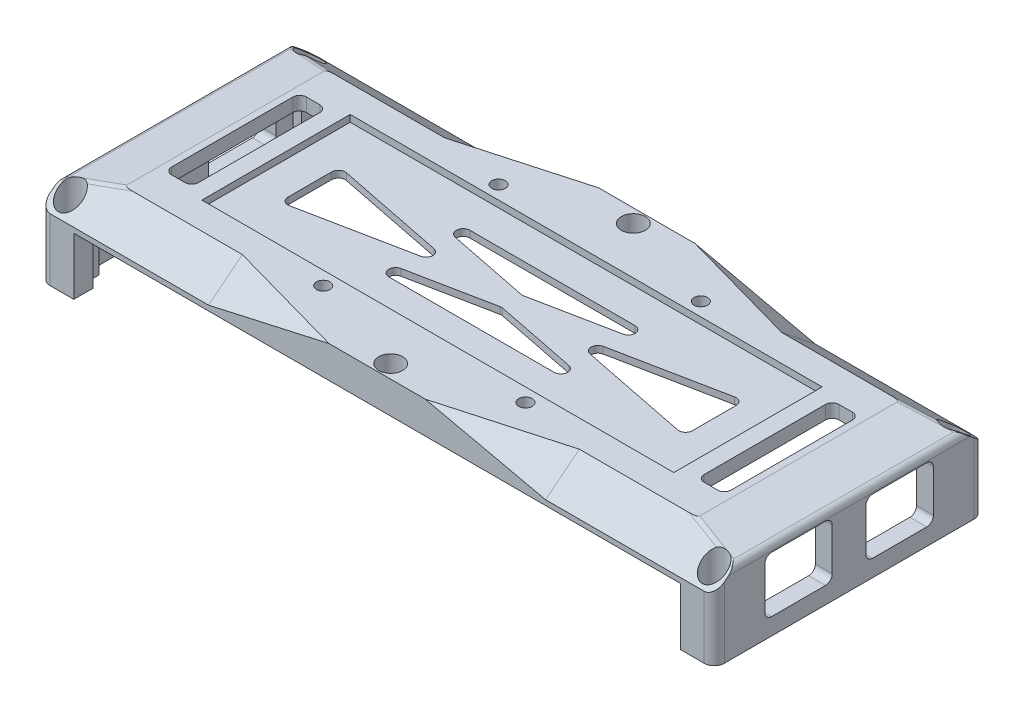
from build123d import *
from OCP.BRepFilletAPI import BRepFilletAPI_MakeChamfer

# Parameters (mm, degrees)
SKETCH_1_W               = 180
SKETCH_1_H               = 60
EXTRUDE_2_DEPTH          = 2
EXTRUDE_5_DEPTH          = 3.5
SKETCH_8_W               = 200
SKETCH_8_H               = 80
EXTRUDE_6_DEPTH          = 4
CHAMFER_4_SIZE           = 3
CHAMFER_4_SIZE2          = 15
SKETCH_10_W              = 10
SKETCH_10_H              = 80
EXTRUDE_7_DEPTH          = 17
CUT_EXTRUDE_1_DEPTH      = 110.636900722
CUT_EXTRUDE_1_DEPTH_BACK = 110.636900722
SKETCH_9_R               = 2
SKETCH_11_R              = 3.55
CUT_EXTRUDE_2_DEPTH      = 25
FILLET_1_R               = 3
SKETCH_12_R              = 3.55
CUT_EXTRUDE_3_DEPTH      = 5
CUT_EXTRUDE_4_DEPTH      = 110.636900722
CUT_EXTRUDE_4_DEPTH_BACK = 110.636900722
SKETCH_13_W              = 20
SKETCH_13_H              = 16.5
SKETCH_14_W              = 140
SKETCH_14_H              = 44
CUT_EXTRUDE_7_DEPTH      = 2
SKETCH_15_W              = 8
SKETCH_15_H              = 40
CUT_EXTRUDE_8_DEPTH      = 111.915508384
SKETCH_9_5_R             = 2
CUT_EXTRUDE_9_DEPTH      = 6
CUT_EXTRUDE_START        = -90
CUT_EXTRUDE_11_DEPTH     = 295.988414307
CHAMFER_3_SIZE           = 7
CHAMFER_3_SIZE_2         = 40
CHAMFER_5_SIZE           = 7
CHAMFER_5_SIZE_2         = 40
FILLET_2_R               = 2
SKETCH_18_W              = 29
SKETCH_18_H              = 13.5
CUT_EXTRUDE_12_DEPTH     = 92.5
SKETCH_19_W              = 5
SKETCH_19_H              = 60
CUT_EXTRUDE_13_DEPTH     = 22.5


with BuildPart() as part:
    # 草圖1 → 填料-伸長2 (new body)
    with BuildSketch(Plane(origin=(0, 0, 0), x_dir=(1, 0, 0), z_dir=(0, 1, 0))):
        Polygon((-100, -40), (100, -40), (100, -20), (100, 0), (100, 40), (-100, 40), align=None)
        Rectangle(SKETCH_1_W, SKETCH_1_H, mode=Mode.SUBTRACT)
    extrude(amount=EXTRUDE_2_DEPTH)

    # 草圖7 → 填料-伸長5 (add)
    with BuildSketch(Plane.XZ):
        Polygon((-100, 40), (-30, 40), (30, 40), (100, 40), (100, -40), (30, -40), (-30, -40), (-100, -40), align=None)
        Polygon((-30, -30), (30, -30), (90, -30), (90, 30), (30, 30), (-30, 30), (-90, 30), (-90, -30), align=None, mode=Mode.SUBTRACT)
    extrude(amount=EXTRUDE_5_DEPTH)

    # 草圖8 → 填料-伸長6 (add)
    with BuildSketch(Plane(origin=(0, 2, 0), x_dir=(1, 0, 0), z_dir=(0, 1, 0))):
        Rectangle(SKETCH_8_W, SKETCH_8_H)
    extrude(amount=EXTRUDE_6_DEPTH)

    # 導角4: one chamfer whose edges measure the first distance from different faces: ONE call of the kernel's chamfer builder (chamfer() names one face for all edges)
    chamfer_4_edges_1 = [part.edges().sort_by_distance(p)[0] for p in [
        (-100, 6, 0),
    ]]
    chamfer_4_side_1 = [part.faces().sort_by_distance(p)[0] for p in [
        (-100, 1.25, 0),
    ]]
    chamfer_4_edges_2 = [part.edges().sort_by_distance(p)[0] for p in [
        (100, 6, 0),
    ]]
    chamfer_4_side_2 = [part.faces().sort_by_distance(p)[0] for p in [
        (100, 1.25, 0),
    ]]
    chamfer_4 = BRepFilletAPI_MakeChamfer(part.part.solid().wrapped)
    for e in chamfer_4_edges_1:
        chamfer_4.Add(CHAMFER_4_SIZE, CHAMFER_4_SIZE2, e.wrapped, chamfer_4_side_1[0].wrapped)  # the first distance lies on this face
    for e in chamfer_4_edges_2:
        chamfer_4.Add(CHAMFER_4_SIZE, CHAMFER_4_SIZE2, e.wrapped, chamfer_4_side_2[0].wrapped)  # the first distance lies on this face
    add(Compound.cast(chamfer_4.Shape()), mode=Mode.REPLACE)

    # 草圖10 → 填料-伸長7 (add)
    with BuildSketch(Plane.XZ.offset(3.5)):
        with Locations((-95, 0)):
            Rectangle(SKETCH_10_W, SKETCH_10_H)
        with Locations((95, 0)):
            Rectangle(SKETCH_10_W, SKETCH_10_H)
    extrude(amount=EXTRUDE_7_DEPTH)

    # 草圖9 → 除料-伸長1 (cut, two sides: drawn at the far end of the back side and taken through both)
    with BuildSketch(Plane(origin=(0, 0, 0), x_dir=(1, 0, 0), z_dir=(0, 1, 0)).offset(-CUT_EXTRUDE_1_DEPTH_BACK)):
        with Locations(Location((95.5, 35.5, 0), (0, 0, 270))):
            Circle(SKETCH_9_R)
        with Locations((-95.5, 35.5)):
            Circle(SKETCH_9_R)
        with Locations(Location((-95.5, -35.5, 0), (0, 0, 270))):
            Circle(SKETCH_9_R)
        with Locations(Location((95.5, -35.5, 0), (0, 0, 180))):
            Circle(SKETCH_9_R)
        with Locations(Location((0, 36, 0), (0, 0, 270))):
            Circle(SKETCH_9_R)
        with Locations(Location((0, -36, 0), (0, 0, 90))):
            Circle(SKETCH_9_R)
    extrude(amount=CUT_EXTRUDE_1_DEPTH + CUT_EXTRUDE_1_DEPTH_BACK, mode=Mode.SUBTRACT)

    # 草圖11 → 除料-伸長2 (cut)
    with BuildSketch(Plane(origin=(0, 6, 0), x_dir=(1, 0, 0), z_dir=(0, 1, 0))):
        with Locations(Location((-95.497380754, 35.5, 0), (0, 0, 270))):
            Circle(SKETCH_11_R)
        with Locations((-95.497380754, -35.5)):
            Circle(SKETCH_11_R)
        with Locations(Location((95.5, -35.5, 0), (0, 0, 270))):
            Circle(SKETCH_11_R)
        with Locations(Location((95.5, 35.5, 0), (0, 0, 180))):
            Circle(SKETCH_11_R)
    extrude(amount=-CUT_EXTRUDE_2_DEPTH, mode=Mode.SUBTRACT)

    # 圓角1
    fillet_1_edges = [part.edges().sort_by_distance(p)[0] for p in [
        (-100, -8.75, 40),
        (100, -8.75, 40),
        (-100, -8.75, -40),
        (100, -8.75, -40),
    ]]
    fillet(fillet_1_edges, radius=FILLET_1_R)

    # 草圖12 → 除料-伸長3 (cut)
    with BuildSketch(Plane(origin=(0, 6, 0), x_dir=(1, 0, 0), z_dir=(0, 1, 0))):
        with Locations(Location((0, 36, 0), (0, 0, 270))):
            Circle(SKETCH_12_R)
        with Locations(Location((0, -36, 0), (0, 0, 270))):
            Circle(SKETCH_12_R)
    extrude(amount=-CUT_EXTRUDE_3_DEPTH, mode=Mode.SUBTRACT)

    # 草圖13 → 除料-伸長4 (cut, two sides: drawn at the far end of the back side and taken through both)
    with BuildSketch(Plane(origin=(0, 0, 0), x_dir=(0, 0, -1), z_dir=(1, 0, 0)).offset(-CUT_EXTRUDE_4_DEPTH_BACK)):
        with Locations((-15, -7.25)):
            Rectangle(SKETCH_13_W, SKETCH_13_H)
        with Locations((15, -7.25)):
            Rectangle(SKETCH_13_W, SKETCH_13_H)
    extrude(amount=CUT_EXTRUDE_4_DEPTH + CUT_EXTRUDE_4_DEPTH_BACK, mode=Mode.SUBTRACT)

    # 草圖14 → 除料-伸長7 (cut)
    with BuildSketch(Plane(origin=(0, 6, 0), x_dir=(1, 0, 0), z_dir=(0, 1, 0))):
        Rectangle(SKETCH_14_W, SKETCH_14_H)
    extrude(amount=-CUT_EXTRUDE_7_DEPTH, mode=Mode.SUBTRACT)

    # 草圖15 → 除料-伸長8 (cut, through all)
    with BuildSketch(Plane(origin=(0, 6, 0), x_dir=(1, 0, 0), z_dir=(0, 1, 0))):
        with Locations((-79, 0)):
            Rectangle(SKETCH_15_W, SKETCH_15_H)
        with Locations((79, 0)):
            Rectangle(SKETCH_15_W, SKETCH_15_H)
        Polygon((-44.702941459, -12), (44.702941459, -12), (0, -3.059411708), align=None)
        Polygon((-60, -8.940588292), (-60, 8.940588292), (-15.297058541, 0), align=None)
        Polygon((-44.702941459, 12), (44.702941459, 12), (0, 3.059411708), align=None)
        Polygon((60, -8.940588292), (60, 8.940588292), (15.297058541, 0), align=None)
    extrude(amount=-CUT_EXTRUDE_8_DEPTH, mode=Mode.SUBTRACT)

    # 草圖9<5> → 除料-伸長9 (cut)
    with BuildSketch(Plane(origin=(0, 0, 0), x_dir=(1, 0, 0), z_dir=(0, 1, 0))):
        with Locations(Location((30, 26, 0), (0, 0, 270))):
            Circle(SKETCH_9_5_R)
        with Locations(Location((-30, 26, 0), (0, 0, 90))):
            Circle(SKETCH_9_5_R)
        with Locations(Location((30, -26, 0), (0, 0, 90))):
            Circle(SKETCH_9_5_R)
        with Locations(Location((-30, -26, 0), (0, 0, 270))):
            Circle(SKETCH_9_5_R)
    extrude(amount=CUT_EXTRUDE_9_DEPTH, mode=Mode.SUBTRACT)

    # 草圖17 → 除料-伸長11 (cut)
    with BuildSketch(Plane(origin=(100, 0, 0), x_dir=(0, 0, -1), z_dir=(1, 0, 0)).offset(CUT_EXTRUDE_START)):
        Polygon((-40, -2), (-30, 6), (-40, 6), align=None)
        Polygon((30, 6), (40, 6), (40, -2), align=None)
    cut_extrude_11 = extrude(amount=CUT_EXTRUDE_11_DEPTH, mode=Mode.SUBTRACT)

    # 鏡射1: 除料-伸長11 across plane
    add(cut_extrude_11.mirror(Plane(origin=(0, 0, 0), x_dir=(0, 0, 1), z_dir=(1, 0, 0))), mode=Mode.SUBTRACT)

    # 導角3
    # the kernel refuses this chamfer: 40, 7 mm, written as the material it adds along each edge
    with BuildSketch(Plane(origin=(-10, -66.932308088, 121.16538511), x_dir=(0, 0.7808688094430304, 0.6246950475544243), z_dir=(0, 0.6246950475544243, -0.7808688094430304))) as chamfer_3_piece_1_section:
        Polygon((CHAMFER_3_SIZE, 0), (0, -CHAMFER_3_SIZE_2), (0, 0), align=None)
    chamfer_3_piece_1 = extrude(amount=220.691066331, mode=Mode.PRIVATE)
    chamfer_3_piece_1 = split(chamfer_3_piece_1, bisect_by=Plane(origin=(-10, -66.932308088, 40), z_dir=(0, 0, -1)), keep=Keep.TOP, mode=Mode.PRIVATE)
    chamfer_3_piece_1 = split(chamfer_3_piece_1, bisect_by=Plane(origin=(-10, 6, 121.16538511), z_dir=(0, -1, 0)), keep=Keep.TOP, mode=Mode.PRIVATE)
    add(chamfer_3_piece_1)
    with BuildSketch(Plane(origin=(-10, -66.932308088, -121.16538511), x_dir=(0, 0.7808688094430304, -0.6246950475544243), z_dir=(0, 0.6246950475544243, 0.7808688094430304))) as chamfer_3_piece_2_section:
        Polygon((CHAMFER_3_SIZE, 0), (0, CHAMFER_3_SIZE_2), (0, 0), align=None)
    chamfer_3_piece_2 = extrude(amount=220.691066331, mode=Mode.PRIVATE)
    chamfer_3_piece_2 = split(chamfer_3_piece_2, bisect_by=Plane(origin=(-10, 6, -121.16538511), z_dir=(0, -1, 0)), keep=Keep.TOP, mode=Mode.PRIVATE)
    chamfer_3_piece_2 = split(chamfer_3_piece_2, bisect_by=Plane(origin=(-10, -66.932308088, -40), z_dir=(0, 0, 1)), keep=Keep.TOP, mode=Mode.PRIVATE)
    add(chamfer_3_piece_2)

    # 導角5
    # the kernel refuses this chamfer: 40, 7 mm, written as the material it adds along each edge
    with BuildSketch(Plane(origin=(10, -66.932308088, -121.16538511), x_dir=(0, 0.7808688094430304, -0.6246950475544243), z_dir=(0, 0.6246950475544243, 0.7808688094430304))) as chamfer_5_piece_1_section:
        Polygon((CHAMFER_5_SIZE, 0), (0, -CHAMFER_5_SIZE_2), (0, 0), align=None)
    chamfer_5_piece_1 = extrude(amount=220.691066331, mode=Mode.PRIVATE)
    chamfer_5_piece_1 = split(chamfer_5_piece_1, bisect_by=Plane(origin=(10, -66.932308088, -40), z_dir=(0, 0, 1)), keep=Keep.TOP, mode=Mode.PRIVATE)
    chamfer_5_piece_1 = split(chamfer_5_piece_1, bisect_by=Plane(origin=(10, 6, -121.16538511), z_dir=(0, -1, 0)), keep=Keep.TOP, mode=Mode.PRIVATE)
    add(chamfer_5_piece_1)
    with BuildSketch(Plane(origin=(10, -66.932308088, 121.16538511), x_dir=(0, 0.7808688094430304, 0.6246950475544243), z_dir=(0, 0.6246950475544243, -0.7808688094430304))) as chamfer_5_piece_2_section:
        Polygon((CHAMFER_5_SIZE, 0), (0, CHAMFER_5_SIZE_2), (0, 0), align=None)
    chamfer_5_piece_2 = extrude(amount=220.691066331, mode=Mode.PRIVATE)
    chamfer_5_piece_2 = split(chamfer_5_piece_2, bisect_by=Plane(origin=(10, -66.932308088, 40), z_dir=(0, 0, -1)), keep=Keep.TOP, mode=Mode.PRIVATE)
    chamfer_5_piece_2 = split(chamfer_5_piece_2, bisect_by=Plane(origin=(10, 6, 121.16538511), z_dir=(0, -1, 0)), keep=Keep.TOP, mode=Mode.PRIVATE)
    add(chamfer_5_piece_2)

    # 圓角2
    # the kernel refuses this fillet: 2 mm, written as the material it adds along each edge
    with BuildSketch(Plane(origin=(75, 6, 20), x_dir=(1, 0, 0), z_dir=(0, -1, 0)), Plane(origin=(83, 6, 20), x_dir=(0, 0, -1), z_dir=(0, -1, 0)), Plane(origin=(83, 6, -20), x_dir=(-1, 0, 0), z_dir=(0, -1, 0)), Plane(origin=(-83, 6, -20), x_dir=(0, 0, 1), z_dir=(0, -1, 0)), Plane(origin=(-75, 6, 20), x_dir=(0, 0, -1), z_dir=(0, -1, 0)), Plane(origin=(-75, 6, -20), x_dir=(-1, 0, 0), z_dir=(0, -1, 0))) as fillet_2_piece_1:
        with BuildLine():
            CenterArc((FILLET_2_R, -FILLET_2_R), FILLET_2_R, 90, 90)
            Line((0, -FILLET_2_R), (0, 0))
            Line((0, 0), (FILLET_2_R, 0))
        make_face()
    extrude(amount=4)
    with BuildSketch(Plane(origin=(75, 6, -20), x_dir=(1, 0, 0), z_dir=(0, -1, 0)), Plane(origin=(-83, 6, 20), x_dir=(0, 0, -1), z_dir=(0, -1, 0))) as fillet_2_piece_2:
        with BuildLine():
            CenterArc((FILLET_2_R, FILLET_2_R), FILLET_2_R, 180, 90)
            Line((0, FILLET_2_R), (0, 0))
            Line((0, 0), (FILLET_2_R, 0))
        make_face()
    extrude(amount=4)
    with BuildSketch(Plane(origin=(90, -15.5, 25), x_dir=(0, 1, 0), z_dir=(1, 0, 0)), Plane(origin=(90, 1, -5), x_dir=(0, 0, -1), z_dir=(1, 0, 0)), Plane(origin=(-90, -15.5, 5), x_dir=(0, 1, 0), z_dir=(-1, 0, 0)), Plane(origin=(-90, -15.5, -5), x_dir=(0, 0, -1), z_dir=(-1, 0, 0))) as fillet_2_piece_3:
        with BuildLine():
            CenterArc((FILLET_2_R, -FILLET_2_R), FILLET_2_R, 90, 90)
            Line((0, -FILLET_2_R), (0, 0))
            Line((0, 0), (FILLET_2_R, 0))
        make_face()
    extrude(amount=10)
    with BuildSketch(Plane(origin=(100, -15.5, -5), x_dir=(0, 1, 0), z_dir=(-1, 0, 0)), Plane(origin=(90, 1, 25), x_dir=(0, -1, 0), z_dir=(1, 0, 0)), Plane(origin=(90, 1, -25), x_dir=(0, 0, 1), z_dir=(1, 0, 0)), Plane(origin=(100, 1, 5), x_dir=(0, -1, 0), z_dir=(-1, 0, 0)), Plane(origin=(100, -15.5, 5), x_dir=(0, 0, 1), z_dir=(-1, 0, 0)), Plane(origin=(100, -15.5, -25), x_dir=(0, 0, 1), z_dir=(-1, 0, 0)), Plane(origin=(-90, 1, 5), x_dir=(0, -1, 0), z_dir=(-1, 0, 0)), Plane(origin=(-90, -15.5, -25), x_dir=(0, 0, 1), z_dir=(-1, 0, 0)), Plane(origin=(-100, -15.5, 25), x_dir=(0, 0, -1), z_dir=(1, 0, 0)), Plane(origin=(-100, 1, 25), x_dir=(0, -1, 0), z_dir=(1, 0, 0)), Plane(origin=(-100, 1, -5), x_dir=(0, -1, 0), z_dir=(1, 0, 0)), Plane(origin=(-100, 1, -25), x_dir=(0, 0, 1), z_dir=(1, 0, 0))) as fillet_2_piece_4:
        with BuildLine():
            CenterArc((FILLET_2_R, FILLET_2_R), FILLET_2_R, 180, 90)
            Line((0, FILLET_2_R), (0, 0))
            Line((0, 0), (FILLET_2_R, 0))
        make_face()
    extrude(amount=10)
    with BuildSketch(Plane(origin=(15.297058541, 4, 0), x_dir=(0.9805806756909202, 0, 0.1961161351381835), z_dir=(0, -1, 0))) as fillet_2_piece_5:
        with BuildLine():
            CenterArc((FILLET_2_R * 5, -FILLET_2_R), FILLET_2_R, 90, 157.380135052)
            Line((FILLET_2_R * 4.61538461538, -FILLET_2_R * 1.92307692308), (0, 0))
            Line((0, 0), (FILLET_2_R * 5, 0))
        make_face()
    extrude(amount=2)
    with BuildSketch(Plane(origin=(60, 4, 8.940588292), x_dir=(-0.9805806756909204, 0, -0.19611613513818263), z_dir=(0, -1, 0)), Plane(origin=(-60, 4, 8.940588292), x_dir=(0, 0, -1), z_dir=(0, -1, 0))) as fillet_2_piece_6:
        with BuildLine():
            CenterArc((FILLET_2_R * 1.21980390272, FILLET_2_R), FILLET_2_R, 168.690067526, 101.309932474)
            Line((FILLET_2_R * 0.239223227028, FILLET_2_R * 1.19611613514), (0, 0))
            Line((0, 0), (FILLET_2_R * 1.21980390272, 0))
        make_face()
    extrude(amount=2)
    with BuildSketch(Plane(origin=(44.702941459, 4, -12), x_dir=(-1, 0, 0), z_dir=(0, -1, 0)), Plane(origin=(44.702941459, 4, 12), x_dir=(-0.9805806756909201, 0, -0.1961161351381839), z_dir=(0, -1, 0))) as fillet_2_piece_7:
        with BuildLine():
            CenterArc((FILLET_2_R * 10.0990195136, -FILLET_2_R), FILLET_2_R, 90, 168.690067526)
            Line((FILLET_2_R * 9.90290337845, -FILLET_2_R * 1.98058067569), (0, 0))
            Line((0, 0), (FILLET_2_R * 10.0990195136, 0))
        make_face()
    extrude(amount=2)
    with BuildSketch(Plane(origin=(-44.702941459, 4, 12), x_dir=(0.980580675690919, 0, -0.19611613513818962), z_dir=(0, -1, 0)), Plane(origin=(-44.702941459, 4, -12), x_dir=(1, 0, 0), z_dir=(0, -1, 0))) as fillet_2_piece_8:
        with BuildLine():
            CenterArc((FILLET_2_R * 10.0990195136, FILLET_2_R), FILLET_2_R, 101.309932474, 168.690067526)
            Line((FILLET_2_R * 9.90290337845, FILLET_2_R * 1.98058067569), (0, 0))
            Line((0, 0), (FILLET_2_R * 10.0990195136, 0))
        make_face()
    extrude(amount=2)
    with BuildSketch(Plane(origin=(0, 4, -3.059411708), x_dir=(-0.9805806756909202, 0, -0.1961161351381838), z_dir=(0, -1, 0))) as fillet_2_piece_9:
        with BuildLine():
            CenterArc((FILLET_2_R * 0.2, FILLET_2_R), FILLET_2_R, 247.380135052, 22.619864948)
            Line((-FILLET_2_R * 0.184615384615, FILLET_2_R * 0.0769230769231), (0, 0))
            Line((0, 0), (FILLET_2_R * 0.2, 0))
        make_face()
    extrude(amount=2)
    with BuildSketch(Plane(origin=(60, 4, -8.940588292), x_dir=(-0.9805806756909192, 0, 0.19611613513818835), z_dir=(0, -1, 0)), Plane(origin=(-60, 4, -8.940588292), x_dir=(0, 0, 1), z_dir=(0, -1, 0))) as fillet_2_piece_10:
        with BuildLine():
            CenterArc((FILLET_2_R * 1.21980390272, -FILLET_2_R), FILLET_2_R, 90, 101.309932474)
            Line((FILLET_2_R * 0.239223227028, -FILLET_2_R * 1.19611613514), (0, 0))
            Line((0, 0), (FILLET_2_R * 1.21980390272, 0))
        make_face()
    extrude(amount=2)
    with BuildSketch(Plane(origin=(0, 4, 3.059411708), x_dir=(-0.9805806756909188, 0, 0.1961161351381906), z_dir=(0, -1, 0))) as fillet_2_piece_11:
        with BuildLine():
            CenterArc((FILLET_2_R * 0.2, -FILLET_2_R), FILLET_2_R, 90, 22.619864948)
            Line((-FILLET_2_R * 0.184615384615, -FILLET_2_R * 0.0769230769231), (0, 0))
            Line((0, 0), (FILLET_2_R * 0.2, 0))
        make_face()
    extrude(amount=2)
    with BuildSketch(Plane(origin=(-15.297058541, 4, 0), x_dir=(-0.9805806756909202, 0, 0.196116135138184), z_dir=(0, -1, 0))) as fillet_2_piece_12:
        with BuildLine():
            CenterArc((FILLET_2_R * 5, FILLET_2_R), FILLET_2_R, 112.619864948, 157.380135052)
            Line((FILLET_2_R * 4.61538461538, FILLET_2_R * 1.92307692308), (0, 0))
            Line((0, 0), (FILLET_2_R * 5, 0))
        make_face()
    extrude(amount=2)
    # the kernel refuses this fillet: 2 mm, written as the material it takes off along each edge
    with BuildSketch(Plane(origin=(-101.734615745, 2.653076851, -34.183653936), x_dir=(-0.23347158945021843, -0.04669431789004709, 0.9712418121129114), z_dir=(0.9523809523809524, 0.19047619047619047, 0.23809523809523808)), Plane(origin=(-101.734615745, 2.653076851, 34.183653936), x_dir=(0.3049106779729928, -0.5949476643375501, 0.7436845804219312), z_dir=(0.9523809523809524, 0.19047619047619047, -0.23809523809523808))) as fillet_2_2_piece_1:
        with BuildLine():
            CenterArc((FILLET_2_R * 0.364269306411, FILLET_2_R), FILLET_2_R, 229.969740728, 40.030259272)
            Line((-FILLET_2_R * 0.278922780012, FILLET_2_R * 0.23429513521), (0, 0))
            Line((0, 0), (FILLET_2_R * 0.364269306411, 0))
        make_face()
    extrude(amount=5.423698978, mode=Mode.SUBTRACT)
    with BuildSketch(Plane(origin=(-95.778822684, 3.844235463, -32.694705671), x_dir=(-0.23347158945021734, -0.046694317890052246, 0.9712418121129113), z_dir=(0.9523809523809524, 0.19047619047619047, 0.23809523809523808)), Plane(origin=(-95.778822684, 3.844235463, 32.694705671), x_dir=(0.30491067797299276, -0.5949476643375479, 0.743684580421933), z_dir=(0.9523809523809524, 0.19047619047619047, -0.23809523809523808))) as fillet_2_2_piece_2:
        with BuildLine():
            CenterArc((FILLET_2_R * 0.364269306411, FILLET_2_R), FILLET_2_R, 229.969740728, 40.030259272)
            Line((-FILLET_2_R * 0.278922780012, FILLET_2_R * 0.23429513521), (0, 0))
            Line((0, 0), (FILLET_2_R * 0.364269306411, 0))
        make_face()
    extrude(amount=14.414052923, mode=Mode.SUBTRACT)
    with BuildSketch(Plane(origin=(-100, 3, 37.849019514), x_dir=(0.9805806756909204, 0.19611613513818235, 0), z_dir=(0, 0, -1)), Plane(origin=(100, 3, -37.849019514), x_dir=(-0.9805806756909214, 0.1961161351381781, 0), z_dir=(0, 0, 1))) as fillet_2_2_piece_3:
        with BuildLine():
            CenterArc((FILLET_2_R * 0.819803902719, FILLET_2_R), FILLET_2_R, 191.309932474, 78.690067526)
            Line((-FILLET_2_R * 0.160776772972, FILLET_2_R * 0.803883864862), (0, 0))
            Line((0, 0), (FILLET_2_R * 0.819803902719, 0))
        make_face()
    extrude(amount=75.698039027, mode=Mode.SUBTRACT)
    with BuildSketch(Plane(origin=(101.734615745, 2.653076851, -34.183653936), x_dir=(0.2334715894502172, -0.04669431789005222, 0.9712418121129115), z_dir=(-0.9523809523809524, 0.1904761904761903, 0.2380952380952379)), Plane(origin=(101.734615745, 2.653076851, 34.183653936), x_dir=(-0.30491067797299254, -0.5949476643375561, 0.7436845804219264), z_dir=(-0.9523809523809524, 0.1904761904761903, -0.2380952380952379))) as fillet_2_2_piece_4:
        with BuildLine():
            CenterArc((FILLET_2_R * 0.364269306411, -FILLET_2_R), FILLET_2_R, 90, 40.030259272)
            Line((-FILLET_2_R * 0.278922780012, -FILLET_2_R * 0.23429513521), (0, 0))
            Line((0, 0), (FILLET_2_R * 0.364269306411, 0))
        make_face()
    extrude(amount=5.420288462, mode=Mode.SUBTRACT)
    with BuildSketch(Plane(origin=(95.780504919, 3.843899016, -32.69512623), x_dir=(0.23347158945021768, -0.04669431789004988, 0.9712418121129115), z_dir=(-0.9523809523809524, 0.1904761904761903, 0.2380952380952379)), Plane(origin=(95.780504919, 3.843899016, 32.69512623), x_dir=(-0.30491067797299254, -0.5949476643375601, 0.7436845804219232), z_dir=(-0.9523809523809524, 0.1904761904761903, -0.2380952380952379))) as fillet_2_2_piece_5:
        with BuildLine():
            CenterArc((FILLET_2_R * 0.364269306411, -FILLET_2_R), FILLET_2_R, 90, 40.030259272)
            Line((-FILLET_2_R * 0.278922780012, -FILLET_2_R * 0.23429513521), (0, 0))
            Line((0, 0), (FILLET_2_R * 0.364269306411, 0))
        make_face()
    extrude(amount=14.415819269, mode=Mode.SUBTRACT)

    # 草圖18 → 除料-伸長12 (cut, symmetric)
    with BuildSketch(Plane(origin=(0, 0, 0), x_dir=(0, 0, -1), z_dir=(1, 0, 0))):
        with Locations((-19.8, -13.75)):
            Rectangle(SKETCH_18_W, SKETCH_18_H)
        with Locations((19.8, -13.75)):
            Rectangle(SKETCH_18_W, SKETCH_18_H)
    extrude(amount=CUT_EXTRUDE_12_DEPTH, both=True, mode=Mode.SUBTRACT)

    # 草圖19 → 除料-伸長13 (cut)
    with BuildSketch(Plane.XZ.offset(20.5)):
        with Locations((-92.5, 0)):
            Rectangle(SKETCH_19_W, SKETCH_19_H)
        with Locations((92.5, 0)):
            Rectangle(SKETCH_19_W, SKETCH_19_H)
    extrude(amount=-CUT_EXTRUDE_13_DEPTH, mode=Mode.SUBTRACT)


solid = part.part
